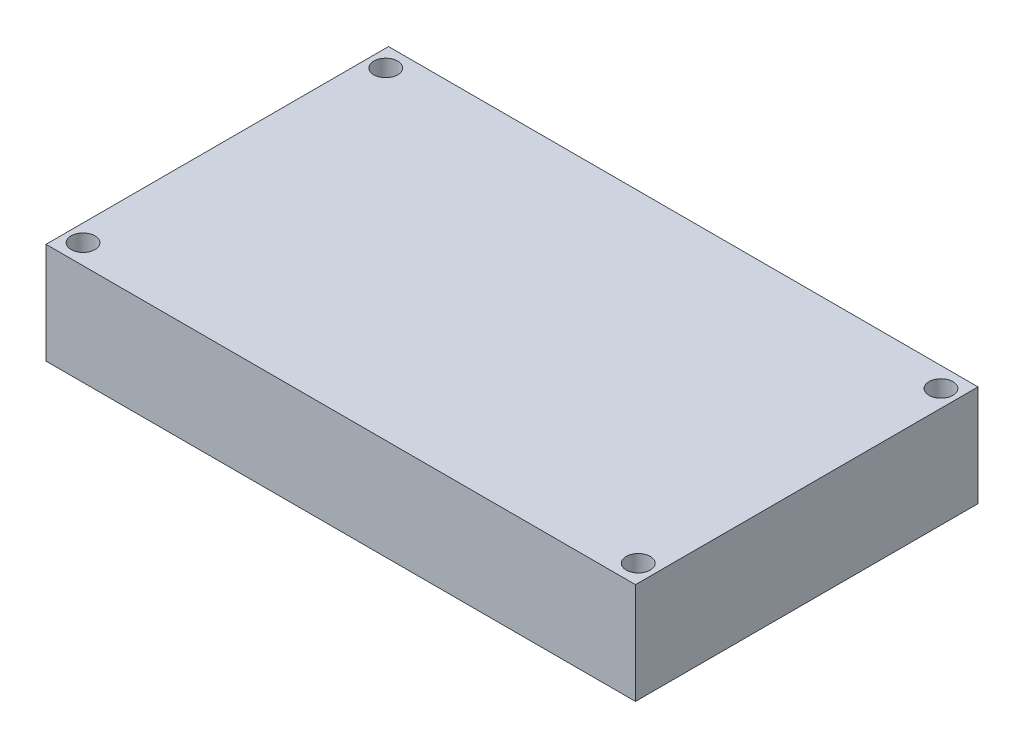
from build123d import *

# Parameters (mm, degrees)
SKETCH1_W           = 74
SKETCH1_H           = 43
SKETCH1_R           = 1.5
BOSS_EXTRUDE1_DEPTH = 12.7


with BuildPart() as part:
    # Sketch1 → Boss-Extrude1 (new body)
    with BuildSketch(Plane(origin=(0, 0, 0), x_dir=(1, 0, 0), z_dir=(0, 1, 0))):
        with Locations((37, 21.5)):
            Rectangle(SKETCH1_W, SKETCH1_H)
        with Locations((2.15, 40.5)):
            Circle(SKETCH1_R, mode=Mode.SUBTRACT)
        with Locations((71.85, 40.5)):
            Circle(SKETCH1_R, mode=Mode.SUBTRACT)
        with Locations((71.85, 2.5)):
            Circle(SKETCH1_R, mode=Mode.SUBTRACT)
        with Locations((2.15, 2.5)):
            Circle(SKETCH1_R, mode=Mode.SUBTRACT)
    extrude(amount=BOSS_EXTRUDE1_DEPTH)


solid = part.part
